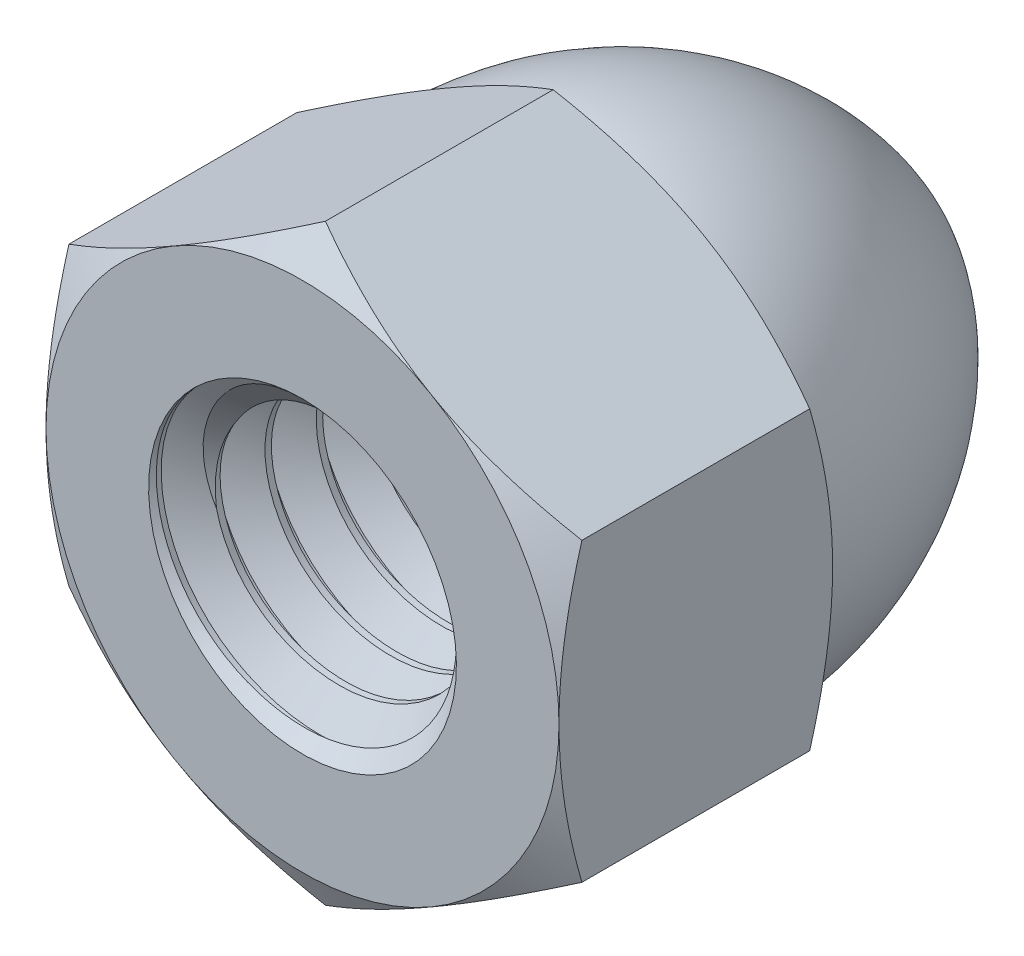
from build123d import *

# Parameters (mm, degrees)
EXTRUDE1_DEPTH     = 5.333333333
SKETCH2_OUTSIDE_W  = 50.97
SKETCH2_OUTSIDE_H  = 52.518
SKETCH2_OUTSIDE_R  = 5
CUT_EXTRUDE1_DEPTH = 10.315459075
CUT_EXTRUDE1_DRAFT = -60
SKETCH3_OUTSIDE_W  = 50.97
SKETCH3_OUTSIDE_H  = 52.518
SKETCH3_OUTSIDE_R  = 5
CUT_EXTRUDE2_DEPTH = 10.315459075
CUT_EXTRUDE2_DRAFT = -60
SKETCH4_R          = 3
CUT_EXTRUDE3_DEPTH = 6
SWEEP1_PITCH       = 1
CUT_EXTRUDE8_DEPTH = 15.224392315


with BuildPart() as part:
    # Sketch1 → Extrude1 (new body)
    with BuildSketch(Plane.XY):
        Polygon((0, 5.773502692), (-5, 2.886751346), (-5, -2.886751346), (0, -5.773502692), (5, -2.886751346), (5, 2.886751346), align=None)
    extrude(amount=-EXTRUDE1_DEPTH)


with BuildPart() as cut_extrude1_tool:
    # Sketch2 outside → Cut-Extrude1 (with draft: the straight prism first)
    with BuildSketch(Plane.XY):
        Rectangle(SKETCH2_OUTSIDE_W, SKETCH2_OUTSIDE_H)
        Circle(SKETCH2_OUTSIDE_R, mode=Mode.SUBTRACT)
    extrude(amount=-CUT_EXTRUDE1_DEPTH)
    # Cut-Extrude1: the draft: its side faces are tilted about the plane it starts from
    cut_extrude1_sides = [cut_extrude1_tool.faces().sort_by_distance(p)[0] for p in [
        (0, -26.259, -5.157729537),
        (25.485, 0, -5.157729537),
        (0, 26.259, -5.157729537),
        (-25.485, 0, -5.157729537),
        (-5, 0, -5.157729537),
    ]]
    draft(cut_extrude1_sides, Plane.XY, CUT_EXTRUDE1_DRAFT)


with BuildPart() as part_1:
    add(part.part)

    # Cut-Extrude1: cut by cut_extrude1_tool
    add(cut_extrude1_tool.part, mode=Mode.SUBTRACT)


with BuildPart() as cut_extrude2_tool:
    # Sketch3 outside → Cut-Extrude2 (with draft: the straight prism first)
    with BuildSketch(Plane(origin=(0, 0, -5.333333333), x_dir=(-1, 0, 0), z_dir=(0, 0, -1))):
        Rectangle(SKETCH3_OUTSIDE_W, SKETCH3_OUTSIDE_H)
        Circle(SKETCH3_OUTSIDE_R, mode=Mode.SUBTRACT)
    extrude(amount=-CUT_EXTRUDE2_DEPTH)
    # Cut-Extrude2: the draft: its side faces are tilted about the plane it starts from
    cut_extrude2_sides = [cut_extrude2_tool.faces().sort_by_distance(p)[0] for p in [
        (0, -26.259, -0.175603796),
        (-25.485, 0, -0.175603796),
        (0, 26.259, -0.175603796),
        (25.485, 0, -0.175603796),
        (5, 0, -0.175603796),
    ]]
    draft(cut_extrude2_sides, Plane(origin=(0, 0, -5.333333333), x_dir=(-1, 0, 0), z_dir=(0, 0, -1)), CUT_EXTRUDE2_DRAFT)


with BuildPart() as part_2:
    add(part_1.part)

    # Cut-Extrude2: cut by cut_extrude2_tool
    add(cut_extrude2_tool.part, mode=Mode.SUBTRACT)

    # Sketch14 → Revolve1 (revolve)
    with BuildSketch(Plane(origin=(0, 0, 0), x_dir=(0, 0, -1), z_dir=(1, 0, 0))):
        with BuildLine():
            Line((5.333333333, 4.95), (5.333333333, 0))
            Line((5.333333333, 0), (12, 0))
            ThreePointArc((12, 0), (9.485048173, 3.577197315), (5.333333333, 4.95))
        make_face()
    revolve(axis=Axis((0, 0, 0), (0, 0, -1)))

    # Sketch4 → Cut-Extrude3 (cut)
    with BuildSketch(Plane.XY):
        Circle(SKETCH4_R)
    extrude(amount=-CUT_EXTRUDE3_DEPTH, mode=Mode.SUBTRACT)

    # Sweep1: the profile of Sketch16 profile screwed along a left-hand helix of 8 turns, 6 arcs to a turn; built about Z, then put on its axis
    sweep1_z = Axis((0, 0, 0), (0, 0, 1))
    sweep1_corners = [(3.0003, 0, 0.000173205), (3.0003, 0, -0.875173205), (2.350480947, 0, -0.5), (2.350480947, 0, -0.375)]
    with BuildLine(mode=Mode.PRIVATE) as sweep1_profile:
        Line(sweep1_corners[0], sweep1_corners[1])
        Line(sweep1_corners[1], sweep1_corners[2])
        Line(sweep1_corners[2], sweep1_corners[3])
        Line(sweep1_corners[3], sweep1_corners[0])
    sweep1_cap = Face(sweep1_profile.wire())
    sweep1_turn_angles = [0, -30, -60, -90, -120, -150, -180, -210, -240, -270, -300, -330, -360]
    sweep1_turn_weights = [1, 0.8660254037844387, 1, 0.8660254037844387, 1, 0.8660254037844387, 1, 0.8660254037844387, 1, 0.8660254037844387, 1, 0.8660254037844387, 1]
    sweep1_turn_rails = [Edge.make_bspline([Vector(p[0], p[1], 0).rotate(sweep1_z, sweep1_turn_angles[k]) / sweep1_turn_weights[k] + Vector(0, 0, p[2] + -SWEEP1_PITCH * sweep1_turn_angles[k] / 360) for k in range(13)], [0, 0, 0, 1, 1, 2, 2, 3, 3, 4, 4, 5, 5, 6, 6, 6], 2, sweep1_turn_weights) for p in sweep1_corners]
    sweep1_turn_sides = [Face.make_surface_from_curves(sweep1_turn_rails[p[0]], sweep1_turn_rails[p[1]]) for p in [(0, 1), (1, 2), (2, 3), (3, 0)]]
    sweep1 = Plane(origin=(0, 0, -6), x_dir=(0, 1, 0), z_dir=(0, 0, 1)) * Solid(Shell([*[p.moved(Location((0, 0, SWEEP1_PITCH * i))) for i in range(8) for p in sweep1_turn_sides], sweep1_cap, sweep1_cap.rotate(sweep1_z, -2880).moved(Location((0, 0, -SWEEP1_PITCH * -2880 / 360)))]))
    add(sweep1)

    # Sketch17 → Cut-Extrude8 (cut, through all)
    with BuildSketch(Plane.XY):
        Polygon((0, 5.773502692), (-5, 2.886751346), (-5, -2.886751346), (0, -5.773502692), (5, -2.886751346), (5, 2.886751346), align=None)
    extrude(amount=CUT_EXTRUDE8_DEPTH, mode=Mode.SUBTRACT)

    # Cut-Extrude9 cone 1 section (through the dimple's axis) → Cut-Extrude9 (revolve, cut)
    with BuildSketch(Plane(origin=(0, 0, 0), x_dir=(0, -1, 0), z_dir=(1, 0, 0))):
        Polygon((0, 0), (3, 0), (0, 3), align=None)
    revolve(axis=Axis((0, 0, 0), (0, 0, -1)), mode=Mode.SUBTRACT)

    # Sketch20 → Cut-Revolve1 (revolve, cut)
    with BuildSketch(Plane(origin=(0, 0, 0), x_dir=(0, 0, -1), z_dir=(1, 0, 0))):
        Polygon((6.333333333, 3), (8.065384141, 0), (6, 0), (6, 3), align=None)
    revolve(axis=Axis((0, 0, 0), (0, 0, 1)), mode=Mode.SUBTRACT)


solid = part_2.part
